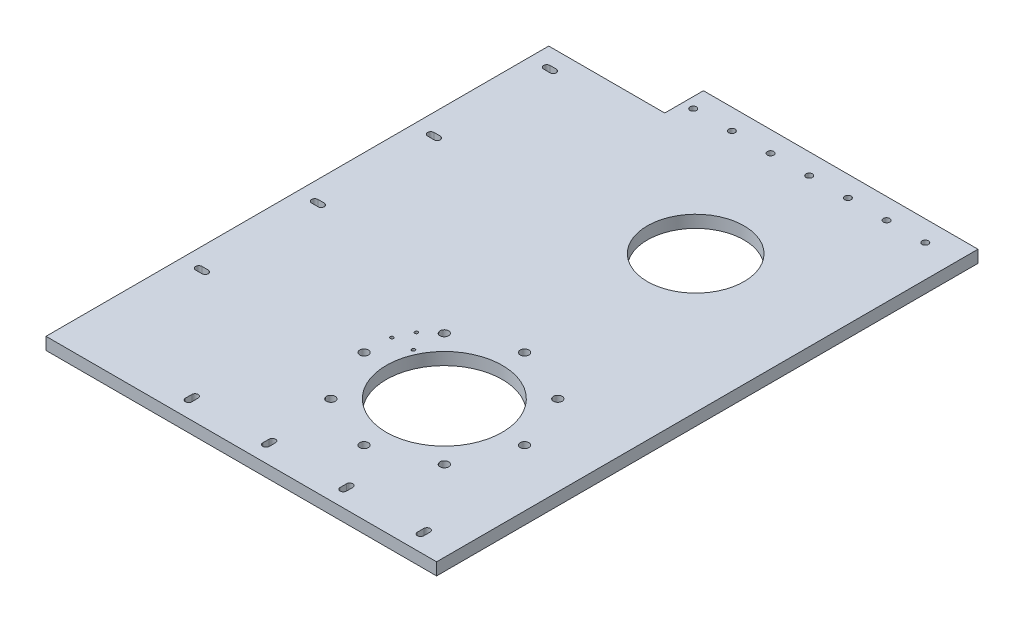
from build123d import *

# Parameters (mm, degrees)
BOSS_EXTRUDE1_DEPTH = 6.35
SKETCH2_R           = 2.25
SKETCH2_R_2         = 30
CUT_EXTRUDE1_DEPTH  = 192.836707905
SKETCH6_R           = 0.85
CUT_EXTRUDE5_DEPTH  = 192.836707905
SKETCH8_R           = 25
CUT_EXTRUDE9_DEPTH  = 192.836707905
SKETCH9_R           = 1.65
CUT_EXTRUDE10_DEPTH = 30
CUT_EXTRUDE12_DEPTH = 30
CUT_EXTRUDE13_DEPTH = 10


with BuildPart() as part:
    # Sketch1 → Boss-Extrude1 (new body)
    with BuildSketch(Plane(origin=(0, 0, 0), x_dir=(1, 0, 0), z_dir=(0, 1, 0))):
        Polygon((-71, 140), (71, 140), (71, -140), (-131, -140), (-131, 120), (-71, 120), align=None)
    extrude(amount=BOSS_EXTRUDE1_DEPTH)

    # Sketch2 → Cut-Extrude1 (cut, through all)
    with BuildSketch(Plane(origin=(0, 6.35, 0), x_dir=(1, 0, 0), z_dir=(0, 1, 0))):
        with Locations((0, -23.5)):
            Circle(SKETCH2_R)
        with Locations((29.344931419, -35.655068581)):
            Circle(SKETCH2_R)
        with Locations((41.5, -65)):
            Circle(SKETCH2_R)
        with Locations((29.344931419, -94.344931419)):
            Circle(SKETCH2_R)
        with Locations((0, -106.5)):
            Circle(SKETCH2_R)
        with Locations((-29.344931419, -94.344931419)):
            Circle(SKETCH2_R)
        with Locations((-41.5, -65)):
            Circle(SKETCH2_R)
        with Locations((-29.344931419, -35.655068581)):
            Circle(SKETCH2_R)
        with Locations((0, -65)):
            Circle(SKETCH2_R_2)
    extrude(amount=-CUT_EXTRUDE1_DEPTH, mode=Mode.SUBTRACT)

    # Sketch6 → Cut-Extrude5 (cut, through all)
    with BuildSketch(Plane(origin=(0, 6.35, 0), x_dir=(1, 0, 0), z_dir=(0, 1, 0))):
        with Locations((-36.963798099, -42.522452757)):
            Circle(SKETCH6_R)
        with Locations((-40.978671586, -51.132376734)):
            Circle(SKETCH6_R)
        with Locations((-29.908156972, -51.053597363)):
            Circle(SKETCH6_R)
    extrude(amount=-CUT_EXTRUDE5_DEPTH, mode=Mode.SUBTRACT)

    # Sketch8 → Cut-Extrude9 (cut, through all)
    with BuildSketch(Plane(origin=(0, 6.35, 0), x_dir=(1, 0, 0), z_dir=(0, 1, 0))):
        with Locations((0, 65)):
            Circle(SKETCH8_R)
    extrude(amount=-CUT_EXTRUDE9_DEPTH, mode=Mode.SUBTRACT)

    # Sketch9 → Cut-Extrude10 (cut)
    with BuildSketch(Plane(origin=(0, 0, 0), x_dir=(-1, 0, 0), z_dir=(0, -1, 0))):
        with Locations((45.6, 129.325)):
            Circle(SKETCH9_R)
        with Locations((5.6, 129.325)):
            Circle(SKETCH9_R)
        with Locations((-34.4, 129.325)):
            Circle(SKETCH9_R)
        with Locations((65.6, 129.325)):
            Circle(SKETCH9_R)
        with Locations((25.6, 129.325)):
            Circle(SKETCH9_R)
        with Locations((-14.4, 129.325)):
            Circle(SKETCH9_R)
        with Locations((-54.4, 129.325)):
            Circle(SKETCH9_R)
    extrude(amount=-CUT_EXTRUDE10_DEPTH, mode=Mode.SUBTRACT)

    # Sketch11 → Cut-Extrude12 (cut)
    with BuildSketch(Plane(origin=(0, 6.35, 0), x_dir=(1, 0, 0), z_dir=(0, 1, 0))):
        with BuildLine():
            Line((-63.95, -128.355), (-63.95, -131.655))
            ThreePointArc((-63.95, -131.655), (-65.6, -133.305), (-67.25, -131.655))
            Line((-67.25, -131.655), (-67.25, -128.355))
            ThreePointArc((-67.25, -128.355), (-65.6, -126.705), (-63.95, -128.355))
        make_face()
        with BuildLine():
            Line((-23.95, -128.353535871), (-23.95, -131.653535871))
            ThreePointArc((-23.95, -131.653535871), (-25.6, -133.303535871), (-27.25, -131.653535871))
            Line((-27.25, -131.653535871), (-27.25, -128.353535871))
            ThreePointArc((-27.25, -128.353535871), (-25.6, -126.703535871), (-23.95, -128.353535871))
        make_face()
        with BuildLine():
            Line((16.05, -128.352071742), (16.05, -131.652071742))
            ThreePointArc((16.05, -131.652071742), (14.4, -133.302071742), (12.75, -131.652071742))
            Line((12.75, -131.652071742), (12.75, -128.352071742))
            ThreePointArc((12.75, -128.352071742), (14.4, -126.702071742), (16.05, -128.352071742))
        make_face()
        with BuildLine():
            Line((56.05, -128.350607613), (56.05, -131.650607613))
            ThreePointArc((56.05, -131.650607613), (54.4, -133.300607613), (52.75, -131.650607613))
            Line((52.75, -131.650607613), (52.75, -128.350607613))
            ThreePointArc((52.75, -128.350607613), (54.4, -126.700607613), (56.05, -128.350607613))
        make_face()
    extrude(amount=-CUT_EXTRUDE12_DEPTH, mode=Mode.SUBTRACT)

    # Sketch10 → Cut-Extrude13 (cut)
    with BuildSketch(Plane.XZ):
        with BuildLine():
            ThreePointArc((-121.975, 11.65), (-123.625, 10), (-121.975, 8.35))
            Line((-121.975, 8.35), (-118.675, 8.35))
            ThreePointArc((-118.675, 8.35), (-117.025, 10), (-118.675, 11.65))
            Line((-118.675, 11.65), (-121.975, 11.65))
        make_face()
        with BuildLine():
            ThreePointArc((-121.975, 71.65), (-123.625, 70), (-121.975, 68.35))
            Line((-121.975, 68.35), (-118.675, 68.35))
            ThreePointArc((-118.675, 68.35), (-117.025, 70), (-118.675, 71.65))
            Line((-118.675, 71.65), (-121.975, 71.65))
        make_face()
        with BuildLine():
            ThreePointArc((-121.975, -48.35), (-123.625, -50), (-121.975, -51.65))
            Line((-121.975, -51.65), (-118.675, -51.65))
            ThreePointArc((-118.675, -51.65), (-117.025, -50), (-118.675, -48.35))
            Line((-118.675, -48.35), (-121.975, -48.35))
        make_face()
        with BuildLine():
            ThreePointArc((-121.975, -108.35), (-123.625, -110), (-121.975, -111.65))
            Line((-121.975, -111.65), (-118.675, -111.65))
            ThreePointArc((-118.675, -111.65), (-117.025, -110), (-118.675, -108.35))
            Line((-118.675, -108.35), (-121.975, -108.35))
        make_face()
    extrude(amount=-CUT_EXTRUDE13_DEPTH, mode=Mode.SUBTRACT)


solid = part.part
